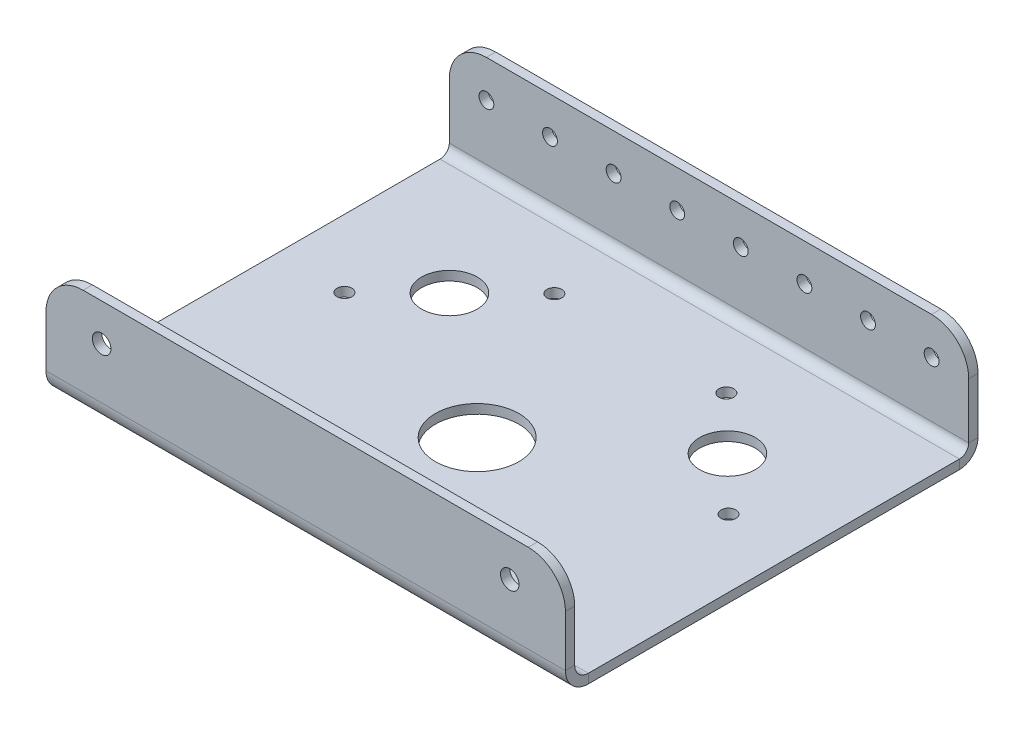
from build123d import *

# Parameters (mm, degrees)
SKETCH1_W           = 177.8
SKETCH1_H           = 127
BOSS_EXTRUDE1_DEPTH = 3.175
EDGE_FLANGE1_DEPTH  = 177.8
EDGE_FLANGE2_DEPTH  = 177.8
SKETCH17_R          = 2.54
CUT_EXTRUDE1_DEPTH  = 5.08
FILLET1_R           = 12.7
SKETCH18_R          = 3.175
CUT_EXTRUDE2_DEPTH  = 5.08
SKETCH19_R          = 14.2875
CUT_EXTRUDE3_DEPTH  = 12.7
SKETCH20_R          = 9.525
CUT_EXTRUDE4_DEPTH  = 12.7
SKETCH21_R          = 2.54
CUT_EXTRUDE6_DEPTH  = 12.7


# Sheet-metal steps are written as plain solids
with BuildPart() as part:
    # Sketch1 → Boss-Extrude1 (new body)
    with BuildSketch(Plane(origin=(0, 0, 0), x_dir=(1, 0, 0), z_dir=(0, 1, 0))):
        Rectangle(SKETCH1_W, SKETCH1_H)
    extrude(amount=BOSS_EXTRUDE1_DEPTH)

    # Edge-Flange1 section (across the edge) → Edge-Flange1 (add)
    with BuildSketch(Plane(origin=(88.9, 3.175, -66.675), x_dir=(0, 0, 1), z_dir=(-1, 0, 0))):
        with BuildLine():
            Line((-3.175, 3.175), (-3.175, 34.925))
            Line((-3.175, 34.925), (0, 34.925))
            Line((0, 34.925), (0, 3.175))
            ThreePointArc((0, 3.175), (0.92993597, 0.92993597), (3.175, 0))
            Line((3.175, 0), (3.175, -3.175))
            ThreePointArc((3.175, -3.175), (-1.315128061, -1.315128061), (-3.175, 3.175))
        make_face()
    extrude(amount=EDGE_FLANGE1_DEPTH)

    # Edge-Flange2 section (across the edge) → Edge-Flange2 (add)
    with BuildSketch(Plane(origin=(-88.9, 3.175, 68.199), x_dir=(0, 0, -1), z_dir=(1, 0, 0))):
        with BuildLine():
            Line((-3.175, 4.699), (-3.175, 34.925))
            Line((-3.175, 34.925), (0, 34.925))
            Line((0, 34.925), (0, 4.699))
            ThreePointArc((0, 4.699), (1.376305235, 1.376305235), (4.699, 0))
            Line((4.699, 0), (4.699, -3.175))
            ThreePointArc((4.699, -3.175), (-0.868758795, -0.868758795), (-3.175, 4.699))
        make_face()
    extrude(amount=EDGE_FLANGE2_DEPTH)

    # Sketch17 → Cut-Extrude1 (cut)
    with BuildSketch(Plane(origin=(0, 0, -69.85), x_dir=(-1, 0, 0), z_dir=(0, 0, -1))):
        with Locations(Location((-76.2, 25.4, 0), (0, 0, 90))):
            Circle(SKETCH17_R)
        with Locations(Location((-54.428571429, 25.4, 0), (0, 0, 90))):
            Circle(SKETCH17_R)
        with Locations(Location((-32.657142857, 25.4, 0), (0, 0, 90))):
            Circle(SKETCH17_R)
        with Locations(Location((-10.885714286, 25.4, 0), (0, 0, 90))):
            Circle(SKETCH17_R)
        with Locations(Location((10.885714286, 25.4, 0), (0, 0, 90))):
            Circle(SKETCH17_R)
        with Locations(Location((32.657142857, 25.4, 0), (0, 0, 90))):
            Circle(SKETCH17_R)
        with Locations(Location((54.428571429, 25.4, 0), (0, 0, 90))):
            Circle(SKETCH17_R)
        with Locations(Location((76.2, 25.4, 0), (0, 0, 90))):
            Circle(SKETCH17_R)
    extrude(amount=-CUT_EXTRUDE1_DEPTH, mode=Mode.SUBTRACT)

    # Fillet1
    fillet1_edges = [part.edges().sort_by_distance(p)[0] for p in [
        (88.9, 38.1, -68.2625),
        (-88.9, 38.1, -68.2625),
        (-88.9, 38.1, 69.7865),
        (88.9, 38.1, 69.7865),
    ]]
    fillet(fillet1_edges, radius=FILLET1_R)

    # Sketch18 → Cut-Extrude2 (cut)
    with BuildSketch(Plane(origin=(0, 0, 68.199), x_dir=(-1, 0, 0), z_dir=(0, 0, -1))):
        with Locations((69.85, 25.4)):
            Circle(SKETCH18_R)
        with Locations((-69.85, 25.4)):
            Circle(SKETCH18_R)
    extrude(amount=-CUT_EXTRUDE2_DEPTH, mode=Mode.SUBTRACT)

    # Sketch19 → Cut-Extrude3 (cut)
    with BuildSketch(Plane(origin=(0, 0, 0), x_dir=(-1, 0, 0), z_dir=(0, -1, 0))):
        with Locations(Location((0, -12.7, 0), (0, 0, 90))):
            Circle(SKETCH19_R)
    extrude(amount=-CUT_EXTRUDE3_DEPTH, mode=Mode.SUBTRACT)

    # Sketch20 → Cut-Extrude4 (cut)
    with BuildSketch(Plane.XZ):
        with Locations(Location((47.586884748, -25.4, 0), (0, 0, 270))):
            Circle(SKETCH20_R)
        with Locations(Location((-47.586884748, -25.4, 0), (0, 0, 270))):
            Circle(SKETCH20_R)
    extrude(amount=-CUT_EXTRUDE4_DEPTH, mode=Mode.SUBTRACT)

    # Sketch21 → Cut-Extrude6 (cut)
    with BuildSketch(Plane(origin=(0, 0, 0), x_dir=(-1, 0, 0), z_dir=(0, -1, 0))):
        with Locations(Location((-65.726112956, 7.62, 0), (0, 0, 90))):
            Circle(SKETCH21_R)
        with Locations(Location((-29.447656539, 43.18, 0), (0, 0, 90))):
            Circle(SKETCH21_R)
        with Locations(Location((65.726112956, 7.62, 0), (0, 0, 90))):
            Circle(SKETCH21_R)
        with Locations(Location((29.447656539, 43.18, 0), (0, 0, 90))):
            Circle(SKETCH21_R)
    extrude(amount=-CUT_EXTRUDE6_DEPTH, mode=Mode.SUBTRACT)


solid = part.part
